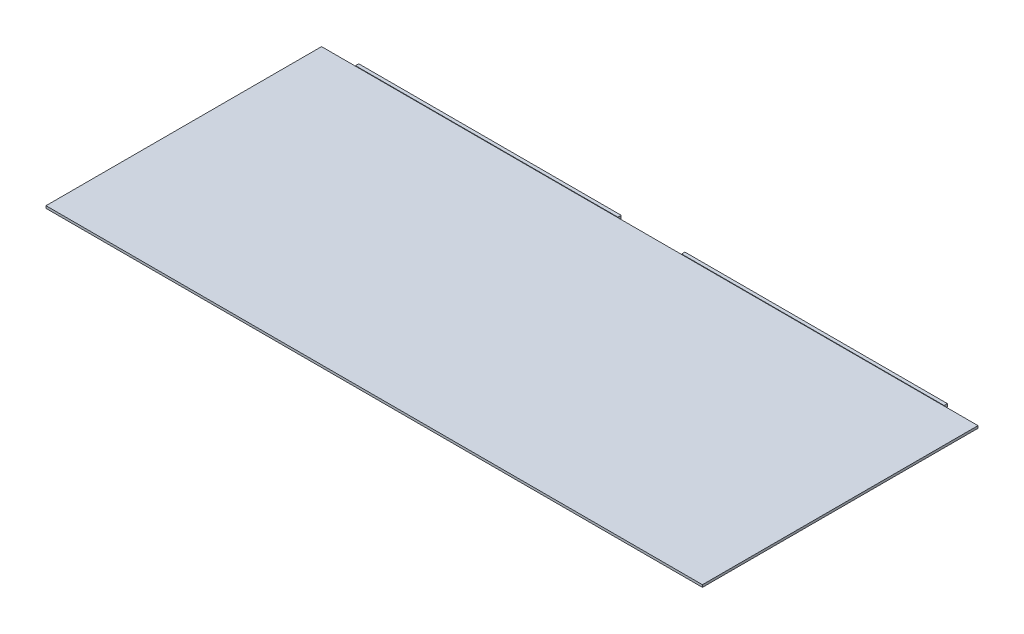
from build123d import *

# Parameters (mm, degrees)
SKETCH1_W           = 635.3556
SKETCH1_H           = 266.7
BOSS_EXTRUDE1_DEPTH = 1.143
SKETCH2_W           = 254
SKETCH2_H           = 2.7305
BOSS_EXTRUDE2_DEPTH = 3.175


with BuildPart() as part:
    # Sketch1 → Boss-Extrude1 (new, symmetric)
    with BuildSketch(Plane(origin=(0, 0, 0), x_dir=(1, 0, 0), z_dir=(0, 1, 0))):
        Rectangle(SKETCH1_W, SKETCH1_H)
    extrude(amount=BOSS_EXTRUDE1_DEPTH, both=True)

    # Sketch2 → Boss-Extrude2 (add)
    with BuildSketch(Plane(origin=(0, 0, -133.35), x_dir=(-1, 0, 0), z_dir=(0, 0, -1))):
        with Locations((-157.8229, 0.22225)):
            Rectangle(SKETCH2_W, SKETCH2_H)
        with Locations((157.8229, 0.22225)):
            Rectangle(SKETCH2_W, SKETCH2_H)
    extrude(amount=BOSS_EXTRUDE2_DEPTH)


solid = part.part
